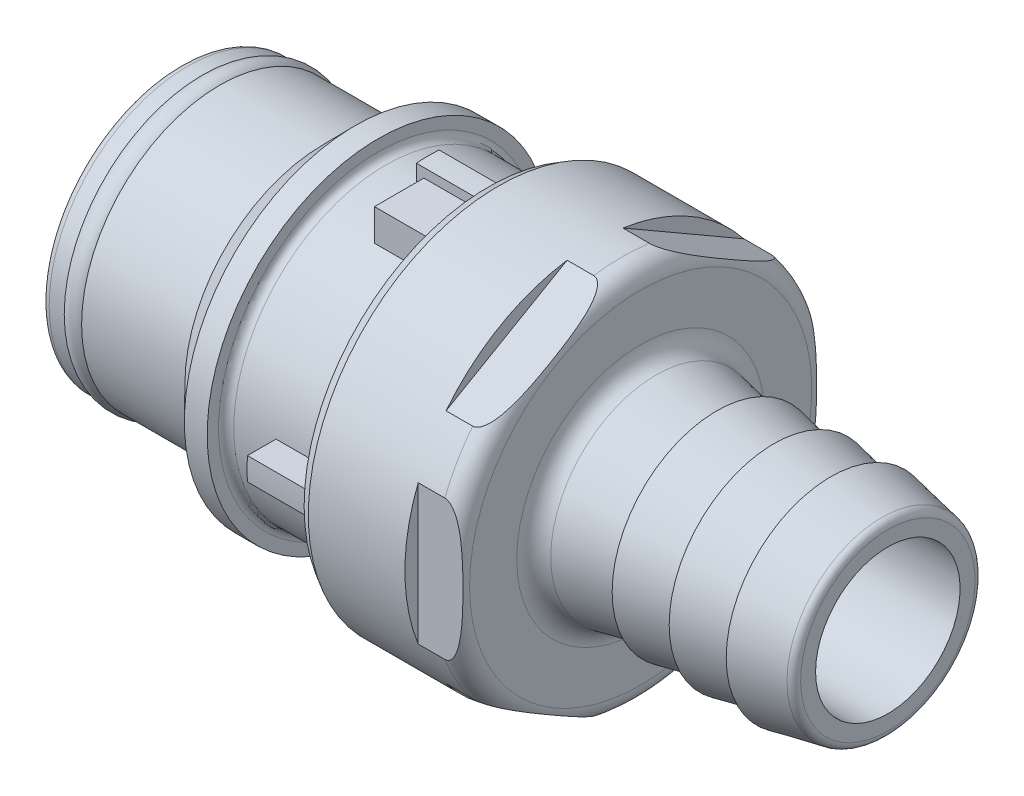
from build123d import *

# Parameters (mm, degrees)
BOSS_EXTRUDE1_DEPTH = 4.064
BOSS_EXTRUDE2_DEPTH = 4.064
BOSS_EXTRUDE3_DEPTH = 3.556
BOSS_EXTRUDE4_DEPTH = 4.064
BOSS_EXTRUDE5_DEPTH = 4.064
SKETCH10_W          = 51.409782041
SKETCH10_H          = 54.244880316
CUT_EXTRUDE1_DEPTH  = 10


with BuildPart() as part:
    # Sketch1 → Revolve1 (revolve)
    with BuildSketch(Plane(origin=(0, 0, 0), x_dir=(-1, 0, 0), z_dir=(0, 0, -1))):
        with BuildLine():
            ThreePointArc((19.6723, 8.7884), (20.5613, 8.146818799), (21.4503, 8.7884))
            ThreePointArc((21.4503, 8.7884), (20.5613, 9.435118303), (19.6723, 8.7884))
        make_face()
    revolve(axis=Axis((-21.4503, 0, 0), (1, 0, 0)))

    # Sketch2 → Revolve2 (revolve)
    with BuildSketch(Plane(origin=(0, 0, 0), x_dir=(-1, 0, 0), z_dir=(0, 0, -1))):
        with BuildLine():
            Line((0, 8.382), (9.558, 8.382))
            Line((9.558, 8.382), (9.558, 7.361434934))
            Line((9.558, 7.361434934), (11.765223515, 7.361434934))
            Line((11.765223515, 7.361434934), (12.202528779, 6.604))
            Line((12.202528779, 6.604), (22.6568, 6.604))
            Line((22.6568, 6.604), (22.6568, 8.7249))
            ThreePointArc((22.6568, 8.7249), (22.508010245, 9.084110245), (22.1488, 9.2329))
            Line((22.1488, 9.2329), (13.081, 9.2329))
            Line((13.081, 9.2329), (10.922, 11.43))
            Line((10.922, 11.43), (9.398, 11.43))
            Line((9.398, 11.43), (9.398, 10.668))
            ThreePointArc((9.398, 10.668), (9.249210245, 10.308789755), (8.89, 10.16))
            Line((8.89, 10.16), (3.302, 10.16))
            ThreePointArc((3.302, 10.16), (2.403974388, 10.531974388), (2.032, 11.43))
            Line((2.032, 11.43), (2.032, 12.318717882))
            Line((2.032, 12.318717882), (1.3716, 12.7))
            Line((1.3716, 12.7), (0, 12.7))
            Line((0, 12.7), (0, 8.382))
        make_face()
    revolve(axis=Axis((-22.6818, 0, 0), (1, 0, 0)))

    # Sketch3 → Revolve3 (revolve)
    with BuildSketch(Plane.XY):
        with BuildLine():
            Line((-25.4, 0), (-25.4, 2.159))
            Line((-25.4, 2.159), (-23.749, 2.159))
            ThreePointArc((-23.749, 2.159), (-22.312159021, 2.754159021), (-21.717, 4.191))
            Line((-21.717, 4.191), (-21.717, 4.572))
            ThreePointArc((-21.717, 4.572), (-21.605407684, 4.841407684), (-21.336, 4.953))
            Line((-21.336, 4.953), (-21.209, 4.953))
            Line((-21.209, 4.953), (-21.209, 3.8862))
            ThreePointArc((-21.209, 3.8862), (-21.060210245, 3.526989755), (-20.701, 3.3782))
            Line((-20.701, 3.3782), (-18.923, 3.3782))
            ThreePointArc((-18.923, 3.3782), (-18.563789755, 3.526989755), (-18.415, 3.8862))
            Line((-18.415, 3.8862), (-18.415, 5.6896))
            Line((-18.415, 5.6896), (-16.7132, 7.3914))
            Line((-16.7132, 7.3914), (-10.668, 7.3914))
            Line((-10.668, 7.3914), (-9.906, 8.1534))
            Line((-9.906, 8.1534), (0.253999123, 8.1534))
            Line((0.253999123, 8.1534), (0.253999123, 7.747000064))
            Line((0.253999123, 7.747000064), (-0.508000877, 6.985000064))
            Line((-0.508000877, 6.985000064), (-9.144346359, 6.985000064))
            Line((-9.144346359, 6.985000064), (-9.143999577, 5.715000064))
            Line((-9.143999577, 5.715000064), (-12.445999577, 5.715000064))
            Line((-12.445999577, 5.715000064), (-14.600186171, 4.206622434))
            ThreePointArc((-14.600186171, 4.206622434), (-15.122449968, 2.945766162), (-14.200444328, 1.93957353))
            Line((-14.200444328, 1.93957353), (-9.708779561, 0.736035491))
            ThreePointArc((-9.708779561, 0.736035491), (-9.301464433, 0.463876212), (-9.143999687, 0))
            Line((-9.143999687, 0), (-25.4, 0))
        make_face()
    revolve(axis=Axis((-9.143999687, 0, 0), (-1, 0, 0)))

    # Sketch4 → Boss-Extrude1 (add)
    with BuildSketch(Plane.ZY.offset(2.032)):
        with BuildLine():
            Line((-0.762, -10.131384703), (-0.762, -12.040912798))
            ThreePointArc((-0.762, -12.040912798), (0, -12.065), (0.762, -12.040912798))
            Line((0.762, -12.040912798), (0.762, -10.131384703))
            ThreePointArc((0.762, -10.131384703), (0, -10.16), (-0.762, -10.131384703))
        make_face()
    extrude(amount=BOSS_EXTRUDE1_DEPTH)

    # Sketch5 → Boss-Extrude2 (add)
    with BuildSketch(Plane.ZY.offset(2.032)):
        with BuildLine():
            Line((-12.040912798, -0.762), (-10.131384703, -0.762))
            ThreePointArc((-10.131384703, -0.762), (-10.16, 0), (-10.131384703, 0.762))
            Line((-10.131384703, 0.762), (-12.040912798, 0.762))
            ThreePointArc((-12.040912798, 0.762), (-12.065, 0), (-12.040912798, -0.762))
        make_face()
    extrude(amount=BOSS_EXTRUDE2_DEPTH)

    # Sketch6 → Boss-Extrude3 (add)
    with BuildSketch(Plane.ZY.offset(2.032)):
        with BuildLine():
            Line((4.064, 9.311793812), (4.064, 11.43))
            Line((4.064, 11.43), (0.762, 11.43))
            Line((0.762, 11.43), (0.762, 12.040912798))
            ThreePointArc((0.762, 12.040912798), (0, 12.065), (-0.762, 12.040912798))
            Line((-0.762, 12.040912798), (-0.762, 10.131384703))
            ThreePointArc((-0.762, 10.131384703), (1.701097677, 10.016579591), (4.064, 9.311793812))
        make_face()
    extrude(amount=BOSS_EXTRUDE3_DEPTH)

    # Sketch7 → Boss-Extrude4 (add)
    with BuildSketch(Plane.ZY.offset(2.032)):
        with BuildLine():
            Line((0.762, 10.131384703), (0.762, 12.040912798))
            ThreePointArc((0.762, 12.040912798), (0, 12.065), (-0.762, 12.040912798))
            Line((-0.762, 12.040912798), (-0.762, 10.131384703))
            ThreePointArc((-0.762, 10.131384703), (0, 10.16), (0.762, 10.131384703))
        make_face()
    extrude(amount=BOSS_EXTRUDE4_DEPTH)

    # Sketch8 → Boss-Extrude5 (add)
    with BuildSketch(Plane.ZY.offset(2.032)):
        with BuildLine():
            Line((10.131384703, -0.762), (12.040912798, -0.762))
            ThreePointArc((12.040912798, -0.762), (12.065, 0), (12.040912798, 0.762))
            Line((12.040912798, 0.762), (10.131384703, 0.762))
            ThreePointArc((10.131384703, 0.762), (10.16, 0), (10.131384703, -0.762))
        make_face()
    extrude(amount=BOSS_EXTRUDE5_DEPTH)

    # Sketch9 → Revolve4 (revolve)
    with BuildSketch(Plane.XZ):
        with BuildLine():
            Line((5.715, 4.826), (24.638, 4.826))
            Line((24.638, 4.826), (24.638, 5.824634406))
            ThreePointArc((24.638, 5.824634406), (24.522031713, 6.147705816), (24.227074267, 6.32327314))
            Line((24.227074267, 6.32327314), (20.828, 6.985))
            Line((20.828, 6.985), (20.828, 6.7056))
            ThreePointArc((20.828, 6.7056), (20.689303558, 6.411576215), (20.3741943, 6.33162095))
            Line((20.3741943, 6.33162095), (17.018, 6.985))
            Line((17.018, 6.985), (17.018, 6.7056))
            ThreePointArc((17.018, 6.7056), (16.879303558, 6.411576215), (16.5641943, 6.33162095))
            Line((16.5641943, 6.33162095), (13.208, 6.985))
            Line((13.208, 6.985), (13.208, 6.7056))
            ThreePointArc((13.208, 6.7056), (13.069303558, 6.411576215), (12.7541943, 6.33162095))
            Line((12.7541943, 6.33162095), (9.155314332, 7.032245695))
            ThreePointArc((9.155314332, 7.032245695), (8.417920718, 7.471164003), (8.128, 8.278842529))
            Line((8.128, 8.278842529), (8.128, 11.43))
            ThreePointArc((8.128, 11.43), (7.756025612, 12.328025612), (6.858, 12.7))
            Line((6.858, 12.7), (0, 12.7))
            Line((0, 12.7), (0, 8.382))
            Line((0, 8.382), (3.302, 8.382))
            Line((3.302, 8.382), (3.302, 7.5565))
            ThreePointArc((3.302, 7.5565), (3.413592316, 7.287092316), (3.683, 7.1755))
            Line((3.683, 7.1755), (5.207, 7.1755))
            ThreePointArc((5.207, 7.1755), (5.566210245, 7.026710245), (5.715, 6.6675))
            Line((5.715, 6.6675), (5.715, 4.826))
        make_face()
    revolve(axis=Axis((24.663000006, 0, 0), (-1, 0, 0)))

    # Sketch10 → Cut-Extrude1 (cut)
    with BuildSketch(Plane(origin=(5.08, 0, 0), x_dir=(0, 0, -1), z_dir=(1, 0, 0))):
        with Locations((0.708774568, -0.89778112)):
            Rectangle(SKETCH10_W, SKETCH10_H)
        Polygon((-11.811, 6.819084029), (-11.811, -6.819084029), (0, -13.638168059), (11.811, -6.819084029), (11.811, 6.819084029), (0, 13.638168059), align=None, mode=Mode.SUBTRACT)
    extrude(amount=CUT_EXTRUDE1_DEPTH, mode=Mode.SUBTRACT)


solid = part.part
